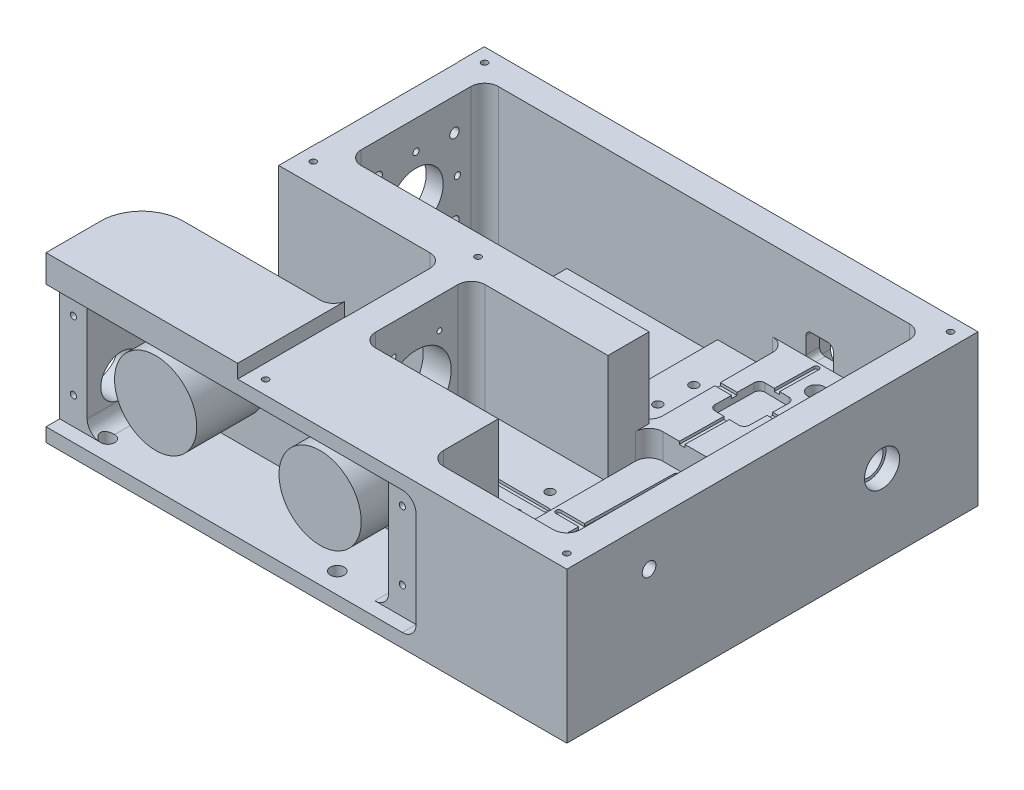
from build123d import *

# Parameters (mm, degrees)
SKETCH7_W                     = 190
SKETCH7_H                     = 150
BOSS_EXTRUDE2_DEPTH           = 60
DIODE_RECESS_REACH            = 260.362
SKETCH8_W                     = 10
SKETCH8_H                     = 50
SKETCH9_W                     = 30
SKETCH9_H                     = 50
COLLIMATION_SPACE_DEPTH       = 55
WAVEPLATE_W                   = 25
WAVEPLATE_H                   = 50
WAVEPLATE_R                   = 1.6
WAVEPLATE_SEAT_DEPTH          = 45
WAVEPLATE_4_R                 = 1.6
WAVEPLATE_HOLES_DEPTH         = 49.8
PBS_PIEZO_MIRROR_CORNER_W     = 25
PBS_PIEZO_MIRROR_CORNER_H     = 50
PBS_MOUNT_DEPTH               = 34.05
EXITWINDOW_W                  = 25
EXITWINDOW_H                  = 50
EXIT_WINDOW_DEPTH             = 34.05
WAVEPLATES_W                  = 49.778354438
WAVEPLATES_H                  = 40
WAVEPLATES_R                  = 1.6
WAVEPLATE_SEAT_2_DEPTH        = 45
WAVEPLATES_3_R                = 1.6
WAVEPLATE_HOLES_2_DEPTH       = 49.8
FIBERPORT_REACH               = 260.362
FIBERDOCK_W                   = 70
FIBERDOCK_H                   = 40
DIODE_THRU_HOLES_REACH        = 212.614
SKETCH20_R                    = 9.9
FIBERPORT_MOUNTING_HOLE_REACH = 164.352
EXIT_WINDOW_THRU_HOLE_REACH   = 212.614
SKETCH24_R                    = 5.35
FILLET7_R                     = 5
FILLET8_R                     = 5
PBS_SEAT_DEPTH                = 37.05
PBS_PIEZO_MIRROR_CORNER_9_W   = 50
PBS_PIEZO_MIRROR_CORNER_9_H   = 80
MIRROR_MOUNT_DEPTH            = 43.4
FILLET11_R                    = 2
FILLET12_R                    = 5
TELESCOPE_W                   = 25
TELESCOPE_H                   = 50
TELESCOPE_INSERT_DEPTH        = 50
SKETCH29_R                    = 6.4
EXIT_WINDOW_SEAT_DEPTH        = 5
CUT_EXTRUDE59_DEPTH           = 3.8
CUT_EXTRUDE60_DEPTH           = 211.613972108
CUT_EXTRUDE60_DEPTH_BACK      = 3.7
SKETCH20_6_R                  = 22.5
APERTURE_W                    = 30
APERTURE_H                    = 50
APERTURE_W_2                  = 15
CUT_EXTRUDE61_DEPTH           = 50
OVERSIZED_8_SCREW_SLOT_REACH  = 260.362
F_8_HEX_NUT_RECESS_DEPTH      = 5
FIBER_BED_DEPTH               = 30
SKETCH28_10_R                 = 15
FIBER_SPOOLS_DEPTH            = 5
CUT_EXTRUDE71_REACH           = 221.222
SKETCH35_R                    = 7.5
FILLET16_R                    = 5
ALIGNMENT_GROOVE1_DEPTH       = 1
ALIGNMENT_GROOVE2_DEPTH       = 1
ALIGNMENT_GROOVE3_DEPTH       = 1
ALIGNMENT_GROOVE5_DEPTH       = 1
PHOTODIODE_WINDOW_DEPTH       = 10
PHOTODIODE_RECESS_DEPTH       = 5
PIEZO_WIRE_EXIT_HOLE_REACH    = 221.222
SKETCH46_R                    = 2.5
ALIGNMENT_GROOVE4_DEPTH       = 1
F_1_4_20_TAPPED_HOLE1_D       = 5.1054
F_1_4_20_TAPPED_HOLE1_DEPTH   = 9.5
F_1_4_20_TAPPED_HOLE1_TIP     = 1.533816902
SKETCH47_W                    = 54
SKETCH47_H                    = 51
TEC_GROOVES_DEPTH             = 1
FILLET17_R                    = 2
FILLET18_R                    = 15
SKETCH50_W                    = 135
SKETCH50_H                    = 45
CUT_EXTRUDE72_DEPTH           = 5
FILLET19_R                    = 5
F_4_40_TAPPED_HOLE1_D         = 2.2606
F_4_40_TAPPED_HOLE1_DEPTH     = 7.6
F_4_40_TAPPED_HOLE1_TIP       = 0.679152758
F_6_32_TAPPED_HOLE1_D         = 2.7051
F_6_32_TAPPED_HOLE3_D         = 2.7051
SKETCH64_R                    = 3
CUT_EXTRUDE73_DEPTH           = 7
CUT_EXTRUDE74_DEPTH           = 5
F_4_40_TAPPED_HOLE2_D         = 2.2606
F_4_40_TAPPED_HOLE2_DEPTH     = 7.6
F_4_40_TAPPED_HOLE2_TIP       = 0.679152758
FILLET25_R                    = 5
CUT_EXTRUDE75_REACH           = 260.362
SKETCH76_W                    = 9.9
SKETCH76_H                    = 10
SKETCH76_H_2                  = 15
SKETCH77_R                    = 4
SKETCH77_R_2                  = 1.5
CUT_EXTRUDE76_DEPTH           = 5
F_8_32_TAPPED_HOLE1_REACH     = 212.614
F_8_32_TAPPED_HOLE1_BORE_R    = 1.7272
F_2_56_START                  = 114.078066781
F_2_56_TAPPED_HOLE1_OUTLINE_R = 0.889
F_2_56_TAPPED_HOLE1_DEPTH     = 10.221645562
F_4_40_TAPPED_HOLE4_REACH     = 209.461
F_4_40_TAPPED_HOLE4_BORE_R    = 1.1303
F_6_32_TAPPED_HOLE4_D         = 2.7051


# Read off the part's stored shape, not the designer's step: #2-56 Tapped Hole1
# Some blends are built 0.0001 mm under size
with BuildPart() as part:
    # Sketch7 → Boss-Extrude2 (new body)
    with BuildSketch(Plane(origin=(0, 0, 0), x_dir=(1, 0, 0), z_dir=(0, 1, 0))):
        with Locations((139.078066781, -16.423439265)):
            Rectangle(SKETCH7_W, SKETCH7_H)
    extrude(amount=BOSS_EXTRUDE2_DEPTH)

    # Sketch8 → diode_recess (cut, up to next)
    with BuildSketch(Plane(origin=(0, 60, 0), x_dir=(1, 0, 0), z_dir=(0, 1, 0)), mode=Mode.PRIVATE) as diode_recess_sk1:
        with Locations((49.078066781, 23.576560735)):
            Rectangle(SKETCH8_W, SKETCH8_H)
    diode_recess_tool1 = extrude(diode_recess_sk1.sketch, amount=-DIODE_RECESS_REACH, mode=Mode.PRIVATE) & part.part
    add(diode_recess_tool1.solids().sort_by_distance((49.078067, 60, -23.576561))[0], mode=Mode.SUBTRACT)

    # Sketch9 → collimation space (cut)
    with BuildSketch(Plane(origin=(0, 60, 0), x_dir=(1, 0, 0), z_dir=(0, 1, 0))):
        with Locations((79.078066781, 23.576560735)):
            Rectangle(SKETCH9_W, SKETCH9_H)
    extrude(amount=-COLLIMATION_SPACE_DEPTH, mode=Mode.SUBTRACT)

    # waveplate → waveplate seat (cut)
    with BuildSketch(Plane(origin=(0, 60, 0), x_dir=(1, 0, 0), z_dir=(0, 1, 0))):
        with Locations((161.578066781, 23.576560735)):
            Rectangle(WAVEPLATE_W, WAVEPLATE_H)
        with Locations(Location((159.078066781, 29.922692486, 0), (0, 0, 270))):
            Circle(WAVEPLATE_R, mode=Mode.SUBTRACT)
        with Locations(Location((158.634843173, 17.230428983, 0), (0, 0, 270))):
            Circle(WAVEPLATE_R, mode=Mode.SUBTRACT)
    extrude(amount=-WAVEPLATE_SEAT_DEPTH, mode=Mode.SUBTRACT)

    # waveplate<4> → waveplate holes (cut)
    with BuildSketch(Plane(origin=(0, 60, 0), x_dir=(1, 0, 0), z_dir=(0, 1, 0))):
        with Locations(Location((159.078066781, 29.922692486, 0), (0, 0, 270))):
            Circle(WAVEPLATE_4_R)
        with Locations(Location((158.634843173, 17.230428983, 0), (0, 0, 270))):
            Circle(WAVEPLATE_4_R)
    extrude(amount=-WAVEPLATE_HOLES_DEPTH, mode=Mode.SUBTRACT)

    # PBS + piezo mirror corner → PBS mount (cut)
    with BuildSketch(Plane(origin=(0, 60, 0), x_dir=(1, 0, 0), z_dir=(0, 1, 0))):
        with Locations((186.578066781, 23.576560735)):
            Rectangle(PBS_PIEZO_MIRROR_CORNER_W, PBS_PIEZO_MIRROR_CORNER_H)
    extrude(amount=-PBS_MOUNT_DEPTH, mode=Mode.SUBTRACT)

    # exitwindow → exit_window (cut)
    with BuildSketch(Plane(origin=(0, 60, 0), x_dir=(1, 0, 0), z_dir=(0, 1, 0))):
        with Locations((211.578066781, 23.576560735)):
            Rectangle(EXITWINDOW_W, EXITWINDOW_H)
    extrude(amount=-EXIT_WINDOW_DEPTH, mode=Mode.SUBTRACT)

    # waveplates → waveplate seat 2 (cut)
    with BuildSketch(Plane(origin=(0, 60, 0), x_dir=(1, 0, 0), z_dir=(0, 1, 0))):
        with Locations((149.188889562, -36.423439265)):
            Rectangle(WAVEPLATES_W, WAVEPLATES_H)
        with Locations(Location((166.578066781, -30.074406401, 0), (0, 0, 270))):
            Circle(WAVEPLATES_R, mode=Mode.SUBTRACT)
        with Locations(Location((166.799712343, -42.77247213, 0), (0, 0, 270))):
            Circle(WAVEPLATES_R, mode=Mode.SUBTRACT)
        with Locations(Location((141.799712343, -30.074406401, 0), (0, 0, 270))):
            Circle(WAVEPLATES_R, mode=Mode.SUBTRACT)
        with Locations(Location((141.578066781, -42.77247213, 0), (0, 0, 270))):
            Circle(WAVEPLATES_R, mode=Mode.SUBTRACT)
    extrude(amount=-WAVEPLATE_SEAT_2_DEPTH, mode=Mode.SUBTRACT)

    # waveplates<3> → waveplate holes 2 (cut)
    with BuildSketch(Plane(origin=(0, 60, 0), x_dir=(1, 0, 0), z_dir=(0, 1, 0))):
        with Locations(Location((166.578066781, -30.074406401, 0), (0, 0, 270))):
            Circle(WAVEPLATES_3_R)
        with Locations(Location((166.799712343, -42.77247213, 0), (0, 0, 270))):
            Circle(WAVEPLATES_3_R)
        with Locations(Location((141.799712343, -30.074406401, 0), (0, 0, 270))):
            Circle(WAVEPLATES_3_R)
        with Locations(Location((141.578066781, -42.77247213, 0), (0, 0, 270))):
            Circle(WAVEPLATES_3_R)
    extrude(amount=-WAVEPLATE_HOLES_2_DEPTH, mode=Mode.SUBTRACT)

    # fiberdock → fiberport (cut, up to next)
    with BuildSketch(Plane(origin=(0, 60, 0), x_dir=(1, 0, 0), z_dir=(0, 1, 0)), mode=Mode.PRIVATE) as fiberport_sk1:
        with Locations((79.078066781, -36.423439265)):
            Rectangle(FIBERDOCK_W, FIBERDOCK_H)
    fiberport_tool1 = extrude(fiberport_sk1.sketch, amount=-FIBERPORT_REACH, mode=Mode.PRIVATE) & part.part
    add(fiberport_tool1.solids().sort_by_distance((79.078067, 60, 36.423439))[0], mode=Mode.SUBTRACT)

    # Sketch20 → diode thru holes (cut, up to next)
    with BuildSketch(Plane.ZY.offset(-54.078066781), mode=Mode.PRIVATE) as diode_thru_holes_sk1:
        with Locations((-23.576560735, 29.3)):
            Circle(SKETCH20_R)
    diode_thru_holes_tool1 = extrude(diode_thru_holes_sk1.sketch, amount=-DIODE_THRU_HOLES_REACH, mode=Mode.PRIVATE) & part.part
    add(diode_thru_holes_tool1.solids().sort_by_distance((54.078067, 29.3, -23.576561))[0], mode=Mode.SUBTRACT)

    # fiberport hole → fiberport mounting hole (cut, up to next)
    with BuildSketch(Plane.ZY.offset(-114.078066781), mode=Mode.PRIVATE) as fiberport_mounting_hole_sk1:
        with BuildLine():
            Line((28.073439265, 19.864031581), (28.073439265, 38.735968419))
            ThreePointArc((28.073439265, 38.735968419), (23.823439265, 29.3), (28.073439265, 19.864031581))
        make_face()
    fiberport_mounting_hole_tool1 = extrude(fiberport_mounting_hole_sk1.sketch, amount=-FIBERPORT_MOUNTING_HOLE_REACH, mode=Mode.PRIVATE) & part.part
    # fiberport hole → fiberport mounting hole (cut, up to next)
    with BuildSketch(Plane.ZY.offset(-114.078066781), mode=Mode.PRIVATE) as fiberport_mounting_hole_sk2:
        with BuildLine():
            Line((36.423439265, 16.7), (36.423439265, 41.9))
            ThreePointArc((36.423439265, 41.9), (31.958755742, 41.082470074), (28.073439265, 38.735968419))
            Line((28.073439265, 38.735968419), (28.073439265, 19.864031581))
            ThreePointArc((28.073439265, 19.864031581), (31.958755742, 17.517529926), (36.423439265, 16.7))
        make_face()
    fiberport_mounting_hole_tool2 = extrude(fiberport_mounting_hole_sk2.sketch, amount=-FIBERPORT_MOUNTING_HOLE_REACH, mode=Mode.PRIVATE) & part.part
    # fiberport hole → fiberport mounting hole (cut, up to next)
    with BuildSketch(Plane.ZY.offset(-114.078066781), mode=Mode.PRIVATE) as fiberport_mounting_hole_sk3:
        with BuildLine():
            ThreePointArc((44.773439265, 38.735968419), (40.888122789, 41.082470074), (36.423439265, 41.9))
            Line((36.423439265, 41.9), (36.423439265, 16.7))
            ThreePointArc((36.423439265, 16.7), (40.888122789, 17.517529926), (44.773439265, 19.864031581))
            Line((44.773439265, 19.864031581), (44.773439265, 38.735968419))
        make_face()
    fiberport_mounting_hole_tool3 = extrude(fiberport_mounting_hole_sk3.sketch, amount=-FIBERPORT_MOUNTING_HOLE_REACH, mode=Mode.PRIVATE) & part.part
    # fiberport hole → fiberport mounting hole (cut, up to next)
    with BuildSketch(Plane.ZY.offset(-114.078066781), mode=Mode.PRIVATE) as fiberport_mounting_hole_sk4:
        with BuildLine():
            ThreePointArc((49.023439265, 29.3), (47.911911749, 34.474456493), (44.773439265, 38.735968419))
            Line((44.773439265, 38.735968419), (44.773439265, 19.864031581))
            ThreePointArc((44.773439265, 19.864031581), (47.911911749, 24.125543507), (49.023439265, 29.3))
        make_face()
    fiberport_mounting_hole_tool4 = extrude(fiberport_mounting_hole_sk4.sketch, amount=-FIBERPORT_MOUNTING_HOLE_REACH, mode=Mode.PRIVATE) & part.part
    add(fiberport_mounting_hole_tool1.solids().sort_by_distance((114.078067, 29.3, 26.346187))[0], mode=Mode.SUBTRACT)
    add(fiberport_mounting_hole_tool2.solids().sort_by_distance((114.078067, 29.3, 32.432284))[0], mode=Mode.SUBTRACT)
    add(fiberport_mounting_hole_tool3.solids().sort_by_distance((114.078067, 29.3, 40.414595))[0], mode=Mode.SUBTRACT)
    add(fiberport_mounting_hole_tool4.solids().sort_by_distance((114.078067, 29.3, 46.500691))[0], mode=Mode.SUBTRACT)

    # Sketch24 → exit window thru hole (cut, up to next)
    with BuildSketch(Plane.ZY.offset(-224.078066781), mode=Mode.PRIVATE) as exit_window_thru_hole_sk1:
        with Locations((-23.576560735, 29.3)):
            Circle(SKETCH24_R)
    exit_window_thru_hole_tool1 = extrude(exit_window_thru_hole_sk1.sketch, amount=-EXIT_WINDOW_THRU_HOLE_REACH, mode=Mode.PRIVATE) & part.part
    add(exit_window_thru_hole_tool1.solids().sort_by_distance((224.078067, 29.3, -23.576561))[0], mode=Mode.SUBTRACT)

    # Fillet7
    fillet7_edges = [part.edges().sort_by_distance(p)[0] for p in [
        (64.078066781, 32.5, 1.423439265),
        (64.078066781, 32.5, -48.576560735),
        (174.078066781, 20.475, 1.423439265),
        (174.078066781, 20.475, -48.576560735),
        (224.078066781, 42.975, -48.576560735),
    ]]
    fillet(fillet7_edges, radius=FILLET7_R)

    # Fillet8
    fillet8_edges = [part.edges().sort_by_distance(p)[0] for p in [
        (124.299712343, 37.5, 16.423439265),
        (124.299712343, 37.5, 56.423439265),
    ]]
    fillet(fillet8_edges, radius=FILLET8_R)

    # PBS + piezo mirror corner<7> → PBS seat (cut)
    with BuildSketch(Plane(origin=(0, 60, 0), x_dir=(1, 0, 0), z_dir=(0, 1, 0))):
        Polygon((180.021969874, 14.689626879), (180.33611319, 32.686885392), (193.134163688, 32.46349459), (192.820020372, 14.466236077), align=None)
    extrude(amount=-PBS_SEAT_DEPTH, mode=Mode.SUBTRACT)

    # PBS + piezo mirror corner<9> → mirror mount (cut)
    with BuildSketch(Plane(origin=(0, 60, 0), x_dir=(1, 0, 0), z_dir=(0, 1, 0))):
        with Locations((199.078066781, -41.423439265)):
            Rectangle(PBS_PIEZO_MIRROR_CORNER_9_W, PBS_PIEZO_MIRROR_CORNER_9_H)
    extrude(amount=-MIRROR_MOUNT_DEPTH, mode=Mode.SUBTRACT)

    # Fillet11
    fillet11_edges = [part.edges().sort_by_distance(p)[0] for p in [
        (180.33611319, 24.45, -32.686885392),
        (193.134163688, 24.45, -32.46349459),
        (192.820020372, 24.45, -14.466236077),
        (180.021969874, 24.45, -14.689626879),
    ]]
    fillet(fillet11_edges, radius=FILLET11_R)

    # Fillet12
    fillet12_edges = [part.edges().sort_by_distance(p)[0] for p in [
        (174.078066781, 21.275, 1.423439265),
        (224.078066781, 21.275, 1.423439265),
        (224.078066781, 38.3, 81.423439265),
        (174.078066781, 38.3, 81.423439265),
    ]]
    fillet(fillet12_edges, radius=FILLET12_R)

    # telescope → telescope_insert (cut)
    with BuildSketch(Plane(origin=(0, 60, 0), x_dir=(1, 0, 0), z_dir=(0, 1, 0))):
        with Locations((106.578066781, 23.576560735)):
            Rectangle(TELESCOPE_W, TELESCOPE_H)
    extrude(amount=-TELESCOPE_INSERT_DEPTH, mode=Mode.SUBTRACT)

    # Sketch29 → exit window seat (cut)
    with BuildSketch(Plane(origin=(234.078066781, 0, 0), x_dir=(0, 0, -1), z_dir=(1, 0, 0))):
        with Locations((23.576560735, 29.3)):
            Circle(SKETCH29_R)
    extrude(amount=-EXIT_WINDOW_SEAT_DEPTH, mode=Mode.SUBTRACT)

    # Sketch20<5> → Cut-Extrude59 (cut)
    with BuildSketch(Plane.ZY.offset(-54.078066781)):
        with BuildLine():
            ThreePointArc((-11.576560735, 29.3), (-15.09127936, 37.785281374), (-23.576560735, 41.3))
            Line((-23.576560735, 41.3), (-23.576560735, 39.2))
            ThreePointArc((-23.576560735, 39.2), (-16.576203601, 36.300357134), (-13.676560735, 29.3))
            ThreePointArc((-13.676560735, 29.3), (-16.576203601, 22.299642866), (-23.576560735, 19.4))
            Line((-23.576560735, 19.4), (-23.576560735, 17.3))
            ThreePointArc((-23.576560735, 17.3), (-15.09127936, 20.814718626), (-11.576560735, 29.3))
        make_face()
        with BuildLine():
            Line((-23.576560735, 39.2), (-23.576560735, 41.3))
            ThreePointArc((-23.576560735, 41.3), (-35.576560735, 29.3), (-23.576560735, 17.3))
            Line((-23.576560735, 17.3), (-23.576560735, 19.4))
            ThreePointArc((-23.576560735, 19.4), (-30.576917868, 22.299642866), (-33.476560735, 29.3))
            ThreePointArc((-33.476560735, 29.3), (-30.576917868, 36.300357134), (-23.576560735, 39.2))
        make_face()
    extrude(amount=-CUT_EXTRUDE59_DEPTH, mode=Mode.SUBTRACT)

    # Sketch20<6> → Cut-Extrude60 (cut, two sides: drawn at the far end of the back side and taken through both)
    with BuildSketch(Plane.ZY.offset(-54.078066781).offset(-CUT_EXTRUDE60_DEPTH_BACK)):
        with Locations((-23.576560735, 29.3)):
            Circle(SKETCH20_6_R)
    extrude(amount=CUT_EXTRUDE60_DEPTH + CUT_EXTRUDE60_DEPTH_BACK, mode=Mode.SUBTRACT)

    # aperture → Cut-Extrude61 (cut)
    with BuildSketch(Plane(origin=(0, 60, 0), x_dir=(1, 0, 0), z_dir=(0, 1, 0))):
        with Locations((134.078066781, 23.576560735)):
            Rectangle(APERTURE_W, APERTURE_H)
        with Locations((126.578066781, 23.576560735)):
            Rectangle(APERTURE_W_2, APERTURE_H)
    extrude(amount=-CUT_EXTRUDE61_DEPTH, mode=Mode.SUBTRACT)

    # PBS + piezo mirror corner<14> → oversized #8 screw slot (cut, up to next)
    with BuildSketch(Plane(origin=(0, 60, 0), x_dir=(1, 0, 0), z_dir=(0, 1, 0)), mode=Mode.PRIVATE) as oversized_8_screw_slot_sk1:
        with BuildLine():
            Line((195.759028214, -56.849834647), (195.933552279, -46.851357695))
            ThreePointArc((195.933552279, -46.851357695), (200.94884178, -42.008148922), (205.792050553, -47.023438423))
            Line((205.792050553, -47.023438423), (205.617526489, -57.021915374))
            ThreePointArc((205.617526489, -57.021915374), (200.602236988, -61.865124147), (195.759028214, -56.849834647))
        make_face()
    oversized_8_screw_slot_tool1 = extrude(oversized_8_screw_slot_sk1.sketch, amount=-OVERSIZED_8_SCREW_SLOT_REACH, mode=Mode.PRIVATE) & part.part
    add(oversized_8_screw_slot_tool1.solids().sort_by_distance((200.775539, 60, 51.936637))[0], mode=Mode.SUBTRACT)

    # Sketch34 → #8 hex nut recess (cut)
    with BuildSketch(Plane.XZ):
        with BuildLine():
            Line((207.245030643, 56.964256986), (207.413974827, 47.285451177))
            ThreePointArc((207.413974827, 47.285451177), (200.973145715, 40.615777386), (194.303471924, 47.056606497))
            Line((194.303471924, 47.056606497), (194.13452774, 56.735412307))
            ThreePointArc((194.13452774, 56.735412307), (200.575356852, 63.405086098), (207.245030643, 56.964256986))
        make_face()
    extrude(amount=-F_8_HEX_NUT_RECESS_DEPTH, mode=Mode.SUBTRACT)

    # Sketch28 → fiber bed (cut)
    with BuildSketch(Plane.XY.offset(91.423439265)):
        with BuildLine():
            Line((94.078066781, 27.5), (109.078066781, 27.5))
            Line((109.078066781, 27.5), (109.078066781, 50))
            Line((109.078066781, 50), (54.078066781, 50))
            Line((54.078066781, 50), (54.078066781, 27.5))
            Line((54.078066781, 27.5), (64.078066781, 27.5))
            ThreePointArc((64.078066781, 27.5), (79.078066781, 42.5), (94.078066781, 27.5))
        make_face()
        with BuildLine():
            Line((109.078066781, 5), (109.078066781, 27.5))
            Line((109.078066781, 27.5), (94.078066781, 27.5))
            ThreePointArc((94.078066781, 27.5), (79.078066781, 12.5), (64.078066781, 27.5))
            Line((64.078066781, 27.5), (54.078066781, 27.5))
            Line((54.078066781, 27.5), (54.078066781, 5))
            Line((54.078066781, 5), (109.078066781, 5))
        make_face()
        with BuildLine():
            ThreePointArc((124.078066781, 27.5), (139.078066781, 42.5), (154.078066781, 27.5))
            Line((154.078066781, 27.5), (164.078066781, 27.5))
            Line((164.078066781, 27.5), (164.078066781, 50))
            Line((164.078066781, 50), (109.078066781, 50))
            Line((109.078066781, 50), (109.078066781, 27.5))
            Line((109.078066781, 27.5), (124.078066781, 27.5))
        make_face()
        with BuildLine():
            Line((164.078066781, 27.5), (154.078066781, 27.5))
            ThreePointArc((154.078066781, 27.5), (139.078066781, 12.5), (124.078066781, 27.5))
            Line((124.078066781, 27.5), (109.078066781, 27.5))
            Line((109.078066781, 27.5), (109.078066781, 5))
            Line((109.078066781, 5), (164.078066781, 5))
            Line((164.078066781, 5), (164.078066781, 27.5))
        make_face()
    extrude(amount=-FIBER_BED_DEPTH, mode=Mode.SUBTRACT)

    # Sketch28<10> → fiber spools (cut)
    with BuildSketch(Plane.XY.offset(91.423439265)):
        with BuildLine():
            ThreePointArc((64.078066781, 27.5), (79.078066781, 12.5), (94.078066781, 27.5))
            Line((94.078066781, 27.5), (64.078066781, 27.5))
        make_face()
        with BuildLine():
            Line((64.078066781, 27.5), (94.078066781, 27.5))
            ThreePointArc((94.078066781, 27.5), (79.078066781, 42.5), (64.078066781, 27.5))
        make_face()
        with Locations((139.078066781, 27.5)):
            Circle(SKETCH28_10_R)
    extrude(amount=-FIBER_SPOOLS_DEPTH, mode=Mode.SUBTRACT)

    # Sketch35 → Cut-Extrude71 (cut, up to next)
    with BuildSketch(Plane.ZY.offset(-44.078066781), mode=Mode.PRIVATE) as cut_extrude71_sk1:
        with Locations((73.923439265, 17.5)):
            Circle(SKETCH35_R)
    cut_extrude71_tool1 = extrude(cut_extrude71_sk1.sketch, amount=-CUT_EXTRUDE71_REACH, mode=Mode.PRIVATE) & part.part
    add(cut_extrude71_tool1.solids().sort_by_distance((44.078067, 17.5, 73.923439))[0], mode=Mode.SUBTRACT)

    # Fillet16
    fillet16_edges = [part.edges().sort_by_distance(p)[0] for p in [
        (164.078066781, 50, 76.423439265),
        (54.078066781, 50, 76.423439265),
        (54.078066781, 5, 76.423439265),
        (164.078066781, 5, 76.423439265),
    ]]
    fillet(fillet16_edges, radius=FILLET16_R - 0.0001)  # a hair under: the kernel refuses the full size

    # Sketch36 → alignment_groove1 (cut)
    with BuildSketch(Plane(origin=(0, 15, 0), x_dir=(1, 0, 0), z_dir=(0, 1, 0))):
        with BuildLine():
            Line((172.587278142, -36.423439265), (125.299712343, -36.423439265))
            ThreePointArc((125.299712343, -36.423439265), (125.592605562, -37.130546047), (126.299712343, -37.423439265))
            Line((126.299712343, -37.423439265), (171.587278142, -37.423439265))
            ThreePointArc((171.587278142, -37.423439265), (172.294384923, -37.130546047), (172.587278142, -36.423439265))
        make_face()
        with BuildLine():
            ThreePointArc((126.299712343, -35.423439265), (125.592605562, -35.716332484), (125.299712343, -36.423439265))
            Line((125.299712343, -36.423439265), (172.587278142, -36.423439265))
            ThreePointArc((172.587278142, -36.423439265), (172.294384923, -35.716332484), (171.587278142, -35.423439265))
            Line((171.587278142, -35.423439265), (126.299712343, -35.423439265))
        make_face()
    extrude(amount=-ALIGNMENT_GROOVE1_DEPTH, mode=Mode.SUBTRACT)

    # Sketch37 → alignment_groove2 (cut)
    with BuildSketch(Plane(origin=(0, 10, 0), x_dir=(1, 0, 0), z_dir=(0, 1, 0))):
        with BuildLine():
            Line((96.078066781, 24.576560735), (147.078066781, 24.576560735))
            ThreePointArc((147.078066781, 24.576560735), (148.078066781, 23.576560735), (147.078066781, 22.576560735))
            Line((147.078066781, 22.576560735), (96.078066781, 22.576560735))
            ThreePointArc((96.078066781, 22.576560735), (95.078066781, 23.576560735), (96.078066781, 24.576560735))
        make_face()
    extrude(amount=-ALIGNMENT_GROOVE2_DEPTH, mode=Mode.SUBTRACT)

    # Sketch39 → alignment_groove3 (cut)
    with BuildSketch(Plane(origin=(0, 25.95, 0), x_dir=(1, 0, 0), z_dir=(0, 1, 0))):
        Polygon((174.078066781, 24.576560735), (174.078066781, 22.576560735), (180.159636817, 22.576560735), (180.194546946, 24.576560735), align=None)
        Polygon((185.420995123, 14.595386543), (185.141385478, -1.423439265), (187.141994837, -1.423439265), (187.420995123, 14.560476413), align=None)
        with BuildLine():
            Line((185.979685579, 46.594013141), (185.735290744, 32.592642397))
            Line((185.735290744, 32.592642397), (187.734986134, 32.557737585))
            Line((187.734986134, 32.557737585), (187.979380969, 46.559108328))
            ThreePointArc((187.979380969, 46.559108328), (186.996985681, 47.57640843), (185.979685579, 46.594013141))
        make_face()
    extrude(amount=-ALIGNMENT_GROOVE3_DEPTH, mode=Mode.SUBTRACT)

    # Sketch41 → alignment_groove5 (cut)
    with BuildSketch(Plane(origin=(0, 16.6, 0), x_dir=(1, 0, 0), z_dir=(0, 1, 0))):
        with BuildLine():
            Line((176.078066781, -35.423439265), (222.078066781, -35.423439265))
            ThreePointArc((222.078066781, -35.423439265), (223.078066781, -36.423439265), (222.078066781, -37.423439265))
            Line((222.078066781, -37.423439265), (176.078066781, -37.423439265))
            ThreePointArc((176.078066781, -37.423439265), (175.078066781, -36.423439265), (176.078066781, -35.423439265))
        make_face()
        with BuildLine():
            Line((187.073811661, -3.442711869), (185.608821705, -79.442711869))
            ThreePointArc((185.608821705, -79.442711869), (184.589734836, -80.423253532), (183.609193173, -79.404166662))
            Line((183.609193173, -79.404166662), (185.074183129, -3.404166662))
            ThreePointArc((185.074183129, -3.404166662), (186.093269998, -2.423624999), (187.073811661, -3.442711869))
        make_face()
    extrude(amount=-ALIGNMENT_GROOVE5_DEPTH, mode=Mode.SUBTRACT)

    # Sketch44 → photodiode window (cut)
    with BuildSketch(Plane(origin=(0, 0, -58.576560735), x_dir=(-1, 0, 0), z_dir=(0, 0, -1))):
        with BuildLine():
            Line((-189.300527141, 24.3), (-183.300527141, 24.3))
            ThreePointArc((-183.300527141, 24.3), (-181.886313579, 24.885786438), (-181.300527141, 26.3))
            Line((-181.300527141, 26.3), (-181.300527141, 32.3))
            ThreePointArc((-181.300527141, 32.3), (-181.886313579, 33.714213562), (-183.300527141, 34.3))
            Line((-183.300527141, 34.3), (-189.300527141, 34.3))
            ThreePointArc((-189.300527141, 34.3), (-190.714740704, 33.714213562), (-191.300527141, 32.3))
            Line((-191.300527141, 32.3), (-191.300527141, 26.3))
            ThreePointArc((-191.300527141, 26.3), (-190.714740704, 24.885786438), (-189.300527141, 24.3))
        make_face()
    extrude(amount=-PHOTODIODE_WINDOW_DEPTH, mode=Mode.SUBTRACT)

    # Sketch44<3> → photodiode recess (cut)
    with BuildSketch(Plane(origin=(0, 0, -58.576560735), x_dir=(-1, 0, 0), z_dir=(0, 0, -1))):
        with BuildLine():
            Line((-187.300527141, 17.7), (-185.300527141, 17.7))
            ThreePointArc((-185.300527141, 17.7), (-181.764993236, 19.164466094), (-180.300527141, 22.7))
            Line((-180.300527141, 22.7), (-180.300527141, 35.9))
            ThreePointArc((-180.300527141, 35.9), (-181.764993236, 39.435533906), (-185.300527141, 40.9))
            Line((-185.300527141, 40.9), (-187.300527141, 40.9))
            ThreePointArc((-187.300527141, 40.9), (-190.836061047, 39.435533906), (-192.300527141, 35.9))
            Line((-192.300527141, 35.9), (-192.300527141, 22.7))
            ThreePointArc((-192.300527141, 22.7), (-190.836061047, 19.164466094), (-187.300527141, 17.7))
        make_face()
    extrude(amount=-PHOTODIODE_RECESS_DEPTH, mode=Mode.SUBTRACT)

    # Sketch46 → piezo wire exit hole (cut, up to next)
    with BuildSketch(Plane(origin=(234.078066781, 0, 0), x_dir=(0, 0, -1), z_dir=(1, 0, 0)), mode=Mode.PRIVATE) as piezo_wire_exit_hole_sk1:
        with Locations((-61.423439265, 40)):
            Circle(SKETCH46_R)
    piezo_wire_exit_hole_tool1 = extrude(piezo_wire_exit_hole_sk1.sketch, amount=-PIEZO_WIRE_EXIT_HOLE_REACH, mode=Mode.PRIVATE) & part.part
    add(piezo_wire_exit_hole_tool1.solids().sort_by_distance((234.078067, 40, 61.423439))[0], mode=Mode.SUBTRACT)

    # Sketch40 → alignment_groove4 (cut)
    with BuildSketch(Plane(origin=(0, 25.95, 0), x_dir=(1, 0, 0), z_dir=(0, 1, 0))):
        with BuildLine():
            ThreePointArc((201.078066781, 22.749202075), (200.078066781, 23.749202075), (201.078066781, 24.749202075))
            Line((201.078066781, 24.749202075), (192.999510211, 24.749202075))
            Line((192.999510211, 24.749202075), (192.964600081, 22.749202075))
            Line((192.964600081, 22.749202075), (201.078066781, 22.749202075))
        make_face()
        with BuildLine():
            Line((222.078066781, 24.749202075), (201.078066781, 24.749202075))
            ThreePointArc((201.078066781, 24.749202075), (200.078066781, 23.749202075), (201.078066781, 22.749202075))
            Line((201.078066781, 22.749202075), (222.078066781, 22.749202075))
            ThreePointArc((222.078066781, 22.749202075), (223.078066781, 23.749202075), (222.078066781, 24.749202075))
        make_face()
    extrude(amount=-ALIGNMENT_GROOVE4_DEPTH, mode=Mode.SUBTRACT)

    # 1/4-20 Tapped Hole1
    with Locations(Plane(origin=(0, 0, 0), x_dir=(-1, 0, 0), z_dir=(0, -1, 0))):
        with Locations((-59.078066781, -83.923439265), (-142.828066781, -83.923439265), (-226.578066781, -83.923439265), (-226.578066781, 51.076560735), (-142.828066781, 51.076560735), (-59.078066781, 51.076560735)):
            Hole(F_1_4_20_TAPPED_HOLE1_D / 2, depth=F_1_4_20_TAPPED_HOLE1_DEPTH)
            with Locations((0, 0, -(F_1_4_20_TAPPED_HOLE1_DEPTH + F_1_4_20_TAPPED_HOLE1_TIP / 2))):  # 118° drill point
                Cone(0, F_1_4_20_TAPPED_HOLE1_D / 2, F_1_4_20_TAPPED_HOLE1_TIP, mode=Mode.SUBTRACT)

    # Sketch47 → TEC grooves (cut)
    with BuildSketch(Plane.XZ):
        with Locations((101.078066781, -25.576560735)):
            Rectangle(SKETCH47_W, SKETCH47_H)
        with Locations((169.828066781, 43.423439265)):
            Rectangle(SKETCH47_W, SKETCH47_H)
        with Locations((184.578066781, -25.576560735)):
            Rectangle(SKETCH47_W, SKETCH47_H)
    extrude(amount=-TEC_GROOVES_DEPTH, mode=Mode.SUBTRACT)

    # Fillet17
    fillet17_edges = [part.edges().sort_by_distance(p)[0] for p in [
        (196.828066781, 0.5, 68.923439265),
        (196.828066781, 0.5, 17.923439265),
        (142.828066781, 0.5, 17.923439265),
        (142.828066781, 0.5, 68.923439265),
        (128.078066781, 0.5, -0.076560735),
        (128.078066781, 0.5, -51.076560735),
        (74.078066781, 0.5, -51.076560735),
        (74.078066781, 0.5, -0.076560735),
        (211.578066781, 0.5, -0.076560735),
        (211.578066781, 0.5, -51.076560735),
        (157.578066781, 0.5, -51.076560735),
        (157.578066781, 0.5, -0.076560735),
    ]]
    fillet(fillet17_edges, radius=FILLET17_R)

    # Fillet18
    # the kernel refuses this fillet: 15 mm, written as the material it takes off along each edge
    with BuildSketch(Plane(origin=(44.078066781, 97.5, 56.423439265), x_dir=(0, 0, 1), z_dir=(0, -1, 0))) as fillet18_piece_1:
        with BuildLine():
            CenterArc((FILLET18_R, -FILLET18_R), FILLET18_R, 90, 90)
            Line((0, -FILLET18_R), (0, 0))
            Line((0, 0), (FILLET18_R, 0))
        make_face()
    extrude(amount=135, mode=Mode.SUBTRACT)

    # Sketch50 → Cut-Extrude72 (cut)
    with BuildSketch(Plane.XY.offset(91.423439265)):
        with Locations((111.578066781, 27.5)):
            Rectangle(SKETCH50_W, SKETCH50_H)
    extrude(amount=-CUT_EXTRUDE72_DEPTH, mode=Mode.SUBTRACT)

    # Fillet19
    fillet19_edges = [part.edges().sort_by_distance(p)[0] for p in [
        (179.078066781, 5, 88.923439265),
        (179.078066781, 50, 88.923439265),
    ]]
    fillet(fillet19_edges, radius=FILLET19_R)

    # #4-40 Tapped Hole1
    with Locations(Plane.XY.offset(86.423439265)):
        with Locations((49.078066781, 40), (49.078066781, 15), (169.078066781, 15), (169.078066781, 40)):
            Hole(F_4_40_TAPPED_HOLE1_D / 2, depth=F_4_40_TAPPED_HOLE1_DEPTH)
            with Locations((0, 0, -(F_4_40_TAPPED_HOLE1_DEPTH + F_4_40_TAPPED_HOLE1_TIP / 2))):  # 118° drill point
                Cone(0, F_4_40_TAPPED_HOLE1_D / 2, F_4_40_TAPPED_HOLE1_TIP, mode=Mode.SUBTRACT)

    # #6-32 Tapped Hole1 (through all)
    with Locations(Plane(origin=(0, 10, 0), x_dir=(1, 0, 0), z_dir=(0, 1, 0))):
        with Locations((99.078066781, 35.576560735), (114.078066781, 35.576560735), (114.078066781, 11.576560735), (99.078066781, 11.576560735)):
            Hole(F_6_32_TAPPED_HOLE1_D / 2)

    # #6-32 Tapped Hole3 (through all)
    with Locations(Plane(origin=(0, 25.95, 0), x_dir=(1, 0, 0), z_dir=(0, 1, 0))):
        with Locations((194.363848047, 39.249199634)):
            Hole(F_6_32_TAPPED_HOLE3_D / 2)

    # Sketch64 → Cut-Extrude73 (cut)
    with BuildSketch(Plane(origin=(0, 25.95, 0), x_dir=(1, 0, 0), z_dir=(0, 1, 0))):
        with Locations(Location((194.363848047, 39.249199634, 0), (0, 0, 270))):
            Circle(SKETCH64_R)
    extrude(amount=-CUT_EXTRUDE73_DEPTH, mode=Mode.SUBTRACT)

    # Sketch71 → Cut-Extrude74 (cut)
    with BuildSketch(Plane(origin=(0, 60, 0), x_dir=(1, 0, 0), z_dir=(0, 1, 0))):
        with BuildLine():
            Line((234.078066781, 58.576560735), (53.978066781, 58.576560735))
            Line((53.978066781, 58.576560735), (53.978066781, -16.423439265))
            Line((53.978066781, -16.423439265), (108.878066781, -16.423439265))
            ThreePointArc((108.878066781, -16.423439265), (112.484311365, -17.917194681), (113.978066781, -21.523439265))
            Line((113.978066781, -21.523439265), (113.978066781, -91.423439265))
            Line((113.978066781, -91.423439265), (234.078066781, -91.423439265))
            Line((234.078066781, -91.423439265), (234.078066781, -16.423439265))
            Line((234.078066781, -16.423439265), (234.078066781, 58.576560735))
        make_face()
    extrude(amount=-CUT_EXTRUDE74_DEPTH, mode=Mode.SUBTRACT)

    # #4-40 Tapped Hole2
    with Locations(Plane(origin=(0, 55, 0), x_dir=(1, 0, 0), z_dir=(0, 1, 0))):
        with Locations((59.078066781, 53.576560735), (229.078066781, 53.576560735), (229.078066781, -86.423439265), (119.188889562, -86.423439265), (119.188889562, -8.923439265), (59.078066781, -8.923439265)):
            Hole(F_4_40_TAPPED_HOLE2_D / 2, depth=F_4_40_TAPPED_HOLE2_DEPTH)
            with Locations((0, 0, -(F_4_40_TAPPED_HOLE2_DEPTH + F_4_40_TAPPED_HOLE2_TIP / 2))):  # 118° drill point
                Cone(0, F_4_40_TAPPED_HOLE2_D / 2, F_4_40_TAPPED_HOLE2_TIP, mode=Mode.SUBTRACT)

    # Fillet25
    fillet25_edges = [part.edges().sort_by_distance(p)[0] for p in [
        (114.078066781, 27.5, 16.423439265),
        (114.078066781, 27.5, 56.423439265),
    ]]
    fillet(fillet25_edges, radius=FILLET25_R)

    # Sketch76 → Cut-Extrude75 (cut, up to next)
    with BuildSketch(Plane(origin=(0, 60, 0), x_dir=(1, 0, 0), z_dir=(0, 1, 0)), mode=Mode.PRIVATE) as cut_extrude75_sk1:
        with Locations((49.028066781, 53.576560735)):
            Rectangle(SKETCH76_W, SKETCH76_H)
    cut_extrude75_tool1 = extrude(cut_extrude75_sk1.sketch, amount=-CUT_EXTRUDE75_REACH, mode=Mode.PRIVATE) & part.part
    # Sketch76 → Cut-Extrude75 (cut, up to next)
    with BuildSketch(Plane(origin=(0, 60, 0), x_dir=(1, 0, 0), z_dir=(0, 1, 0)), mode=Mode.PRIVATE) as cut_extrude75_sk2:
        with Locations((49.028066781, -8.923439265)):
            Rectangle(SKETCH76_W, SKETCH76_H_2)
    cut_extrude75_tool2 = extrude(cut_extrude75_sk2.sketch, amount=-CUT_EXTRUDE75_REACH, mode=Mode.PRIVATE) & part.part
    add(cut_extrude75_tool1.solids().sort_by_distance((49.028067, 60, -53.576561))[0], mode=Mode.SUBTRACT)
    add(cut_extrude75_tool2.solids().sort_by_distance((49.028067, 60, 8.923439))[0], mode=Mode.SUBTRACT)

    # Sketch77 → Cut-Extrude76 (cut)
    with BuildSketch(Plane.ZY.offset(-53.978066781)):
        with Locations((8.923439265, 35)):
            Circle(SKETCH77_R)
        with Locations((8.923439265, 15)):
            Circle(SKETCH77_R_2)
    extrude(amount=-CUT_EXTRUDE76_DEPTH, mode=Mode.SUBTRACT)

    # #8-32 Tapped Hole1 bore → #8-32 Tapped Hole1 (cut, up to next)
    with BuildSketch(Plane.ZY.offset(-54.078066781), mode=Mode.PRIVATE) as f_8_32_tapped_hole1_sk1:
        with Locations((-37.576560735, 43.3)):
            Circle(F_8_32_TAPPED_HOLE1_BORE_R)
    f_8_32_tapped_hole1_tool1 = extrude(f_8_32_tapped_hole1_sk1.sketch, amount=-F_8_32_TAPPED_HOLE1_REACH, mode=Mode.PRIVATE) & part.part
    # #8-32 Tapped Hole1 bore → #8-32 Tapped Hole1 (cut, up to next)
    with BuildSketch(Plane.ZY.offset(-54.078066781), mode=Mode.PRIVATE) as f_8_32_tapped_hole1_sk2:
        with Locations((-9.576560735, 43.3)):
            Circle(F_8_32_TAPPED_HOLE1_BORE_R)
    f_8_32_tapped_hole1_tool2 = extrude(f_8_32_tapped_hole1_sk2.sketch, amount=-F_8_32_TAPPED_HOLE1_REACH, mode=Mode.PRIVATE) & part.part
    # #8-32 Tapped Hole1 bore → #8-32 Tapped Hole1 (cut, up to next)
    with BuildSketch(Plane.ZY.offset(-54.078066781), mode=Mode.PRIVATE) as f_8_32_tapped_hole1_sk3:
        with Locations((-9.576560735, 15.3)):
            Circle(F_8_32_TAPPED_HOLE1_BORE_R)
    f_8_32_tapped_hole1_tool3 = extrude(f_8_32_tapped_hole1_sk3.sketch, amount=-F_8_32_TAPPED_HOLE1_REACH, mode=Mode.PRIVATE) & part.part
    # #8-32 Tapped Hole1 bore → #8-32 Tapped Hole1 (cut, up to next)
    with BuildSketch(Plane.ZY.offset(-54.078066781), mode=Mode.PRIVATE) as f_8_32_tapped_hole1_sk4:
        with Locations((-37.576560735, 15.3)):
            Circle(F_8_32_TAPPED_HOLE1_BORE_R)
    f_8_32_tapped_hole1_tool4 = extrude(f_8_32_tapped_hole1_sk4.sketch, amount=-F_8_32_TAPPED_HOLE1_REACH, mode=Mode.PRIVATE) & part.part
    add(f_8_32_tapped_hole1_tool1.solids().sort_by_distance((54.078067, 43.3, -37.576561))[0], mode=Mode.SUBTRACT)
    add(f_8_32_tapped_hole1_tool2.solids().sort_by_distance((54.078067, 43.3, -9.576561))[0], mode=Mode.SUBTRACT)
    add(f_8_32_tapped_hole1_tool3.solids().sort_by_distance((54.078067, 15.3, -9.576561))[0], mode=Mode.SUBTRACT)
    add(f_8_32_tapped_hole1_tool4.solids().sort_by_distance((54.078067, 15.3, -37.576561))[0], mode=Mode.SUBTRACT)

    # #2-56 Tapped Hole1 outline → #2-56 Tapped Hole1 (cut)
    with BuildSketch(Plane.YZ.offset(F_2_56_START)):
        with Locations((14.85, 28.073439265)):
            Circle(F_2_56_TAPPED_HOLE1_OUTLINE_R)
        with Locations((14.85, 44.773439265)):
            Circle(F_2_56_TAPPED_HOLE1_OUTLINE_R)
        with Locations((43.75, 44.773439265)):
            Circle(F_2_56_TAPPED_HOLE1_OUTLINE_R)
        with Locations((43.75, 28.073439265)):
            Circle(F_2_56_TAPPED_HOLE1_OUTLINE_R)
    extrude(amount=F_2_56_TAPPED_HOLE1_DEPTH, mode=Mode.SUBTRACT)

    # #4-40 Tapped Hole4 bore → #4-40 Tapped Hole4 (cut, up to next)
    with BuildSketch(Plane.ZY.offset(-57.778066781), mode=Mode.PRIVATE) as f_4_40_tapped_hole4_sk1:
        with Locations((-23.576560735, 44.375)):
            Circle(F_4_40_TAPPED_HOLE4_BORE_R)
    f_4_40_tapped_hole4_tool1 = extrude(f_4_40_tapped_hole4_sk1.sketch, amount=-F_4_40_TAPPED_HOLE4_REACH, mode=Mode.PRIVATE) & part.part
    # #4-40 Tapped Hole4 bore → #4-40 Tapped Hole4 (cut, up to next)
    with BuildSketch(Plane.ZY.offset(-57.778066781), mode=Mode.PRIVATE) as f_4_40_tapped_hole4_sk2:
        with Locations((-38.651560735, 29.3)):
            Circle(F_4_40_TAPPED_HOLE4_BORE_R)
    f_4_40_tapped_hole4_tool2 = extrude(f_4_40_tapped_hole4_sk2.sketch, amount=-F_4_40_TAPPED_HOLE4_REACH, mode=Mode.PRIVATE) & part.part
    # #4-40 Tapped Hole4 bore → #4-40 Tapped Hole4 (cut, up to next)
    with BuildSketch(Plane.ZY.offset(-57.778066781), mode=Mode.PRIVATE) as f_4_40_tapped_hole4_sk3:
        with Locations((-23.576560735, 14.225)):
            Circle(F_4_40_TAPPED_HOLE4_BORE_R)
    f_4_40_tapped_hole4_tool3 = extrude(f_4_40_tapped_hole4_sk3.sketch, amount=-F_4_40_TAPPED_HOLE4_REACH, mode=Mode.PRIVATE) & part.part
    # #4-40 Tapped Hole4 bore → #4-40 Tapped Hole4 (cut, up to next)
    with BuildSketch(Plane.ZY.offset(-57.778066781), mode=Mode.PRIVATE) as f_4_40_tapped_hole4_sk4:
        with Locations((-8.501560735, 29.3)):
            Circle(F_4_40_TAPPED_HOLE4_BORE_R)
    f_4_40_tapped_hole4_tool4 = extrude(f_4_40_tapped_hole4_sk4.sketch, amount=-F_4_40_TAPPED_HOLE4_REACH, mode=Mode.PRIVATE) & part.part
    add(f_4_40_tapped_hole4_tool1.solids().sort_by_distance((57.778067, 44.375, -23.576561))[0], mode=Mode.SUBTRACT)
    add(f_4_40_tapped_hole4_tool2.solids().sort_by_distance((57.778067, 29.3, -38.651561))[0], mode=Mode.SUBTRACT)
    add(f_4_40_tapped_hole4_tool3.solids().sort_by_distance((57.778067, 14.225, -23.576561))[0], mode=Mode.SUBTRACT)
    add(f_4_40_tapped_hole4_tool4.solids().sort_by_distance((57.778067, 29.3, -8.501561))[0], mode=Mode.SUBTRACT)

    # #6-32 Tapped Hole4 (through all)
    with Locations(Plane(origin=(0, 10, 0), x_dir=(1, 0, 0), z_dir=(0, 1, 0))):
        with Locations((124.078066781, 33.576560735), (124.078066781, 13.576560735)):
            Hole(F_6_32_TAPPED_HOLE4_D / 2)


solid = part.part
